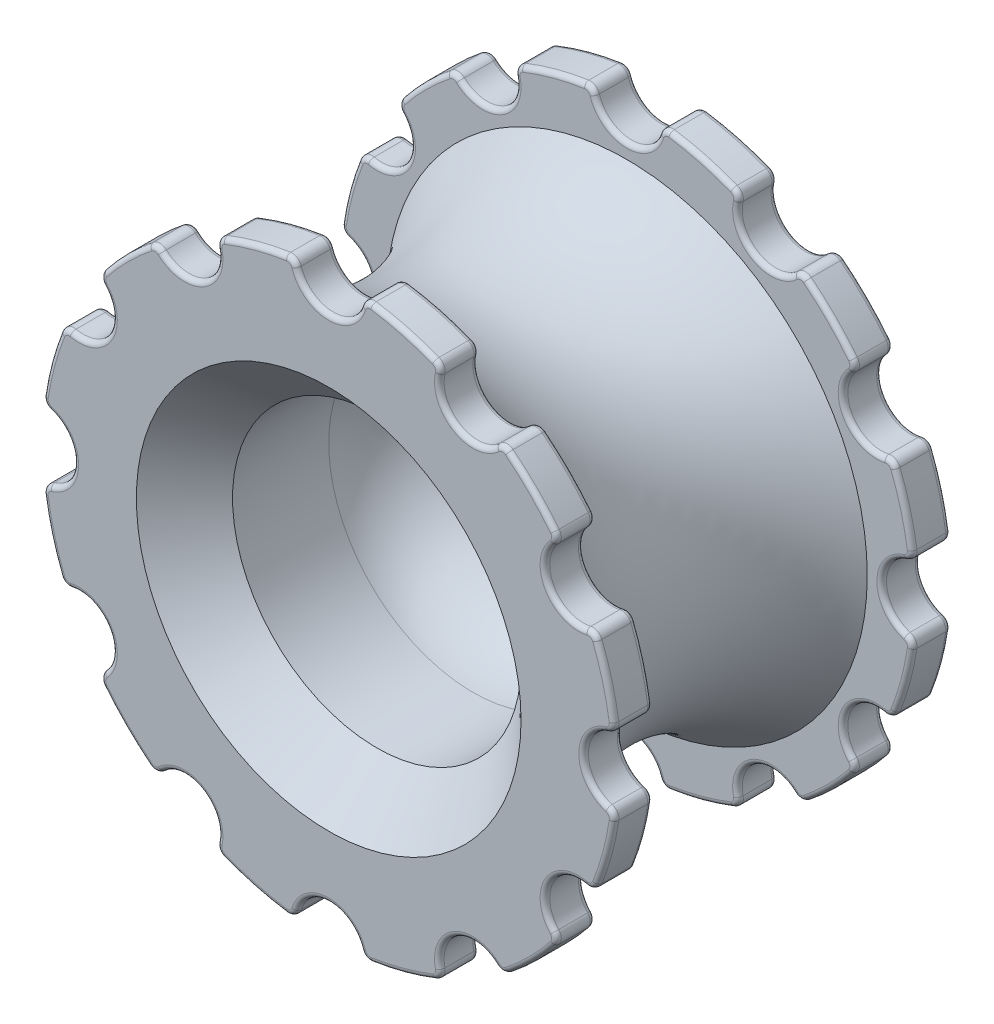
from build123d import *

# Parameters (mm, degrees)
EXTRUDE_1_DEPTH     = 35
FILLET_1_R          = 1
SKETCH_3_R          = 15
CUT_EXTRUDE_1_DEPTH = 25
FILLET_2_R          = 0.5
FILLET_3_R          = 10
CHAMFER_1_SIZE      = 5
SKETCH_4_R          = 6
EXTRUDE_2_DEPTH     = 1
SKETCH_5_R          = 4.75
EXTRUDE_3_DEPTH     = 4.25
SKETCH_6_R          = 1.5
CUT_EXTRUDE_2_DEPTH = 38


with BuildPart() as part:
    # Эскиз1 → Бобышка-Вытянуть1 (new body)
    with BuildSketch(Plane.XY):
        with BuildLine():
            ThreePointArc((-3.494040064, 29.795833333), (0, 26.5), (3.494040064, 29.795833333))
            ThreePointArc((3.494040064, 29.795833333), (7.764571353, 28.977774789), (11.871989209, 27.550968626))
            ThreePointArc((11.871989209, 27.550968626), (13.25, 22.9496732), (17.923844124, 24.056928561))
            ThreePointArc((17.923844124, 24.056928561), (21.213203436, 21.213203436), (24.056928561, 17.923844124))
            ThreePointArc((24.056928561, 17.923844124), (22.9496732, 13.25), (27.550968626, 11.871989209))
            ThreePointArc((27.550968626, 11.871989209), (28.977774789, 7.764571353), (29.795833333, 3.494040064))
            ThreePointArc((29.795833333, 3.494040064), (26.5, 0), (29.795833333, -3.494040064))
            ThreePointArc((29.795833333, -3.494040064), (28.977774789, -7.764571353), (27.550968626, -11.871989209))
            ThreePointArc((27.550968626, -11.871989209), (22.9496732, -13.25), (24.056928561, -17.923844124))
            ThreePointArc((24.056928561, -17.923844124), (21.213203436, -21.213203436), (17.923844124, -24.056928561))
            ThreePointArc((17.923844124, -24.056928561), (13.25, -22.9496732), (11.871989209, -27.550968626))
            ThreePointArc((11.871989209, -27.550968626), (7.764571353, -28.977774789), (3.494040064, -29.795833333))
            ThreePointArc((3.494040064, -29.795833333), (0, -26.5), (-3.494040064, -29.795833333))
            ThreePointArc((-3.494040064, -29.795833333), (-7.764571353, -28.977774789), (-11.871989209, -27.550968626))
            ThreePointArc((-11.871989209, -27.550968626), (-13.25, -22.9496732), (-17.923844124, -24.056928561))
            ThreePointArc((-17.923844124, -24.056928561), (-21.213203436, -21.213203436), (-24.056928561, -17.923844124))
            ThreePointArc((-24.056928561, -17.923844124), (-22.9496732, -13.25), (-27.550968626, -11.871989209))
            ThreePointArc((-27.550968626, -11.871989209), (-28.977774789, -7.764571353), (-29.795833333, -3.494040064))
            ThreePointArc((-29.795833333, -3.494040064), (-26.5, 0), (-29.795833333, 3.494040064))
            ThreePointArc((-29.795833333, 3.494040064), (-28.977774789, 7.764571353), (-27.550968626, 11.871989209))
            ThreePointArc((-27.550968626, 11.871989209), (-22.9496732, 13.25), (-24.056928561, 17.923844124))
            ThreePointArc((-24.056928561, 17.923844124), (-21.213203436, 21.213203436), (-17.923844124, 24.056928561))
            ThreePointArc((-17.923844124, 24.056928561), (-13.25, 22.9496732), (-11.871989209, 27.550968626))
            ThreePointArc((-11.871989209, 27.550968626), (-7.764571353, 28.977774789), (-3.494040064, 29.795833333))
        make_face()
    extrude(amount=EXTRUDE_1_DEPTH)

    # Скругление1
    fillet_1_edges = [part.edges().sort_by_distance(p)[0] for p in [
        (3.494040064, 29.795833333, 17.5),
        (11.871989209, 27.550968626, 17.5),
        (17.923844124, 24.056928561, 17.5),
        (29.795833333, 3.494040064, 17.5),
        (27.550968626, 11.871989209, 17.5),
        (24.056928561, 17.923844124, 17.5),
        (29.795833333, -3.494040064, 17.5),
        (27.550968626, -11.871989209, 17.5),
        (17.923844124, -24.056928561, 17.5),
        (24.056928561, -17.923844124, 17.5),
        (11.871989209, -27.550968626, 17.5),
        (-11.871989209, -27.550968626, 17.5),
        (3.494040064, -29.795833333, 17.5),
        (-3.494040064, -29.795833333, 17.5),
        (-17.923844124, -24.056928561, 17.5),
        (-24.056928561, -17.923844124, 17.5),
        (-27.550968626, -11.871989209, 17.5),
        (-29.795833333, -3.494040064, 17.5),
        (-29.795833333, 3.494040064, 17.5),
        (-27.550968626, 11.871989209, 17.5),
        (-24.056928561, 17.923844124, 17.5),
        (-17.923844124, 24.056928561, 17.5),
        (-11.871989209, 27.550968626, 17.5),
        (-3.494040064, 29.795833333, 17.5),
    ]]
    fillet(fillet_1_edges, radius=FILLET_1_R)

    # Эскиз2 → Вырез-Повернуть1 (revolve, cut)
    with BuildSketch(Plane(origin=(0, 0, 0), x_dir=(1, 0, 0), z_dir=(0, 1, 0))):
        with BuildLine():
            Line((-30, -4), (-30, -31))
            Line((-30, -31), (-25, -31))
            ThreePointArc((-25, -31), (-19.756354563, -17.5), (-25, -4))
            Line((-25, -4), (-30, -4))
        make_face()
    revolve(axis=Axis((0, 0, 1000), (0, 0, -1)), mode=Mode.SUBTRACT)

    # Эскиз3 → Вырез-Вытянуть1 (cut)
    with BuildSketch(Plane.XY.offset(35)):
        Circle(SKETCH_3_R)
    extrude(amount=-CUT_EXTRUDE_1_DEPTH, mode=Mode.SUBTRACT)

    # Скругление2
    fillet_2_edges = [part.edges().sort_by_distance(p)[0] for p in [
        (-29.525356682, -3.768908965, 4),
        (-26.5, 0, 4),
        (-29.525356682, 3.768908965, 4),
        (-28.977774789, 7.764571353, 4),
        (-27.454163425, 11.498707433, 4),
        (-22.9496732, 13.25, 4),
        (-23.68525446, 18.02664925, 4),
        (-21.213203436, 21.213203436, 4),
        (-18.02664925, 23.68525446, 4),
        (-13.25, 22.9496732, 4),
        (-11.498707433, 27.454163425, 4),
        (-7.764571353, 28.977774789, 4),
        (-3.768908965, 29.525356682, 4),
        (0, 26.5, 4),
        (3.768908965, 29.525356682, 4),
        (7.764571353, 28.977774789, 4),
        (11.498707433, 27.454163425, 4),
        (13.25, 22.9496732, 4),
        (18.02664925, 23.68525446, 4),
        (21.213203436, 21.213203436, 4),
        (23.68525446, 18.02664925, 4),
        (22.9496732, 13.25, 4),
        (27.454163425, 11.498707433, 4),
        (28.977774789, 7.764571353, 4),
        (29.525356682, 3.768908965, 4),
        (26.5, 0, 4),
        (29.525356682, -3.768908965, 4),
        (28.977774789, -7.764571353, 4),
        (27.454163425, -11.498707433, 4),
        (22.9496732, -13.25, 4),
        (23.68525446, -18.02664925, 4),
        (21.213203436, -21.213203436, 4),
        (18.02664925, -23.68525446, 4),
        (13.25, -22.9496732, 4),
        (11.498707433, -27.454163425, 4),
        (7.764571353, -28.977774789, 4),
        (3.768908965, -29.525356682, 4),
        (0, -26.5, 4),
        (-3.768908965, -29.525356682, 4),
        (-7.764571353, -28.977774789, 4),
        (-11.498707433, -27.454163425, 4),
        (-13.25, -22.9496732, 4),
        (-18.02664925, -23.68525446, 4),
        (-21.213203436, -21.213203436, 4),
        (-23.68525446, -18.02664925, 4),
        (-22.9496732, -13.25, 4),
        (-27.454163425, -11.498707433, 4),
        (-29.525356682, -3.768908965, 31),
        (-26.5, 0, 31),
        (-29.525356682, 3.768908965, 31),
        (-28.977774789, 7.764571353, 31),
        (-27.454163425, 11.498707433, 31),
        (-22.9496732, 13.25, 31),
        (-23.68525446, 18.02664925, 31),
        (-21.213203436, 21.213203436, 31),
        (-18.02664925, 23.68525446, 31),
        (-13.25, 22.9496732, 31),
        (-11.498707433, 27.454163425, 31),
        (-7.764571353, 28.977774789, 31),
        (-3.768908965, 29.525356682, 31),
        (0, 26.5, 31),
        (3.768908965, 29.525356682, 31),
        (7.764571353, 28.977774789, 31),
        (11.498707433, 27.454163425, 31),
        (13.25, 22.9496732, 31),
        (18.02664925, 23.68525446, 31),
        (21.213203436, 21.213203436, 31),
        (23.68525446, 18.02664925, 31),
        (22.9496732, 13.25, 31),
        (27.454163425, 11.498707433, 31),
        (28.977774789, 7.764571353, 31),
        (29.525356682, 3.768908965, 31),
        (26.5, 0, 31),
        (29.525356682, -3.768908965, 31),
        (28.977774789, -7.764571353, 31),
        (27.454163425, -11.498707433, 31),
        (22.9496732, -13.25, 31),
        (23.68525446, -18.02664925, 31),
        (21.213203436, -21.213203436, 31),
        (18.02664925, -23.68525446, 31),
        (13.25, -22.9496732, 31),
        (11.498707433, -27.454163425, 31),
        (7.764571353, -28.977774789, 31),
        (3.768908965, -29.525356682, 31),
        (0, -26.5, 31),
        (-3.768908965, -29.525356682, 31),
        (-7.764571353, -28.977774789, 31),
        (-11.498707433, -27.454163425, 31),
        (-13.25, -22.9496732, 31),
        (-18.02664925, -23.68525446, 31),
        (-21.213203436, -21.213203436, 31),
        (-23.68525446, -18.02664925, 31),
        (-22.9496732, -13.25, 31),
        (-27.454163425, -11.498707433, 31),
        (-29.525356682, 3.768908965, 35),
        (-28.977774789, 7.764571353, 35),
        (-27.454163425, 11.498707433, 35),
        (-22.9496732, 13.25, 35),
        (-23.68525446, 18.02664925, 35),
        (-21.213203436, 21.213203436, 35),
        (-18.02664925, 23.68525446, 35),
        (-13.25, 22.9496732, 35),
        (-11.498707433, 27.454163425, 35),
        (-7.764571353, 28.977774789, 35),
        (-3.768908965, 29.525356682, 35),
        (0, 26.5, 35),
        (3.768908965, 29.525356682, 35),
        (7.764571353, 28.977774789, 35),
        (11.498707433, 27.454163425, 35),
        (13.25, 22.9496732, 35),
        (18.02664925, 23.68525446, 35),
        (21.213203436, 21.213203436, 35),
        (23.68525446, 18.02664925, 35),
        (22.9496732, 13.25, 35),
        (27.454163425, 11.498707433, 35),
        (28.977774789, 7.764571353, 35),
        (29.525356682, 3.768908965, 35),
        (26.5, 0, 35),
        (29.525356682, -3.768908965, 35),
        (28.977774789, -7.764571353, 35),
        (27.454163425, -11.498707433, 35),
        (22.9496732, -13.25, 35),
        (23.68525446, -18.02664925, 35),
        (21.213203436, -21.213203436, 35),
        (18.02664925, -23.68525446, 35),
        (13.25, -22.9496732, 35),
        (11.498707433, -27.454163425, 35),
        (7.764571353, -28.977774789, 35),
        (3.768908965, -29.525356682, 35),
        (0, -26.5, 35),
        (-3.768908965, -29.525356682, 35),
        (-7.764571353, -28.977774789, 35),
        (-11.498707433, -27.454163425, 35),
        (-13.25, -22.9496732, 35),
        (-18.02664925, -23.68525446, 35),
        (-21.213203436, -21.213203436, 35),
        (-23.68525446, -18.02664925, 35),
        (-22.9496732, -13.25, 35),
        (-27.454163425, -11.498707433, 35),
        (-28.977774789, -7.764571353, 35),
        (-29.525356682, -3.768908965, 35),
        (3.768908965, 29.525356682, 0),
        (0, 26.5, 0),
        (-3.768908965, 29.525356682, 0),
        (-7.764571353, 28.977774789, 0),
        (-11.498707433, 27.454163425, 0),
        (-13.25, 22.9496732, 0),
        (-18.02664925, 23.68525446, 0),
        (-21.213203436, 21.213203436, 0),
        (-23.68525446, 18.02664925, 0),
        (-22.9496732, 13.25, 0),
        (-27.454163425, 11.498707433, 0),
        (-28.977774789, 7.764571353, 0),
        (-29.525356682, 3.768908965, 0),
        (-26.5, 0, 0),
        (-29.525356682, -3.768908965, 0),
        (-28.977774789, -7.764571353, 0),
        (-27.454163425, -11.498707433, 0),
        (-22.9496732, -13.25, 0),
        (-23.68525446, -18.02664925, 0),
        (-21.213203436, -21.213203436, 0),
        (-18.02664925, -23.68525446, 0),
        (-13.25, -22.9496732, 0),
        (-11.498707433, -27.454163425, 0),
        (-7.764571353, -28.977774789, 0),
        (-3.768908965, -29.525356682, 0),
        (0, -26.5, 0),
        (3.768908965, -29.525356682, 0),
        (7.764571353, -28.977774789, 0),
        (11.498707433, -27.454163425, 0),
        (13.25, -22.9496732, 0),
        (18.02664925, -23.68525446, 0),
        (21.213203436, -21.213203436, 0),
        (23.68525446, -18.02664925, 0),
        (22.9496732, -13.25, 0),
        (27.454163425, -11.498707433, 0),
        (28.977774789, -7.764571353, 0),
        (29.525356682, -3.768908965, 0),
        (26.5, 0, 0),
        (29.525356682, 3.768908965, 0),
        (28.977774789, 7.764571353, 0),
        (27.454163425, 11.498707433, 0),
        (22.9496732, 13.25, 0),
        (23.68525446, 18.02664925, 0),
        (21.213203436, 21.213203436, 0),
        (18.02664925, 23.68525446, 0),
        (13.25, 22.9496732, 0),
        (11.498707433, 27.454163425, 0),
        (7.764571353, 28.977774789, 0),
        (-28.977774789, -7.764571353, 4),
        (-28.977774789, -7.764571353, 31),
        (-26.5, 0, 35),
    ]]
    fillet(fillet_2_edges, radius=FILLET_2_R)

    # Скругление3
    fillet_3_edges = [part.edges().sort_by_distance(p)[0] for p in [
        (-15, 0, 10),
    ]]
    fillet(fillet_3_edges, radius=FILLET_3_R)

    # Фаска1
    chamfer_1_edges = [part.edges().sort_by_distance(p)[0] for p in [
        (-15, 0, 35),
    ]]
    chamfer(chamfer_1_edges, length=CHAMFER_1_SIZE)

    # Эскиз4 → Бобышка-Вытянуть2 (add)
    with BuildSketch(Plane(origin=(0, 0, 0), x_dir=(-1, 0, 0), z_dir=(0, 0, -1))):
        Circle(SKETCH_4_R)
    extrude(amount=EXTRUDE_2_DEPTH)

    # Эскиз5 → Бобышка-Вытянуть3 (add)
    with BuildSketch(Plane(origin=(0, 0, -1), x_dir=(-1, 0, 0), z_dir=(0, 0, -1))):
        Circle(SKETCH_5_R)
    extrude(amount=EXTRUDE_3_DEPTH)

    # Эскиз6 → Вырез-Вытянуть2 (cut)
    with BuildSketch(Plane(origin=(0, 0, -5.25), x_dir=(-1, 0, 0), z_dir=(0, 0, -1))):
        Circle(SKETCH_6_R)
    extrude(amount=-CUT_EXTRUDE_2_DEPTH, mode=Mode.SUBTRACT)


solid = part.part
